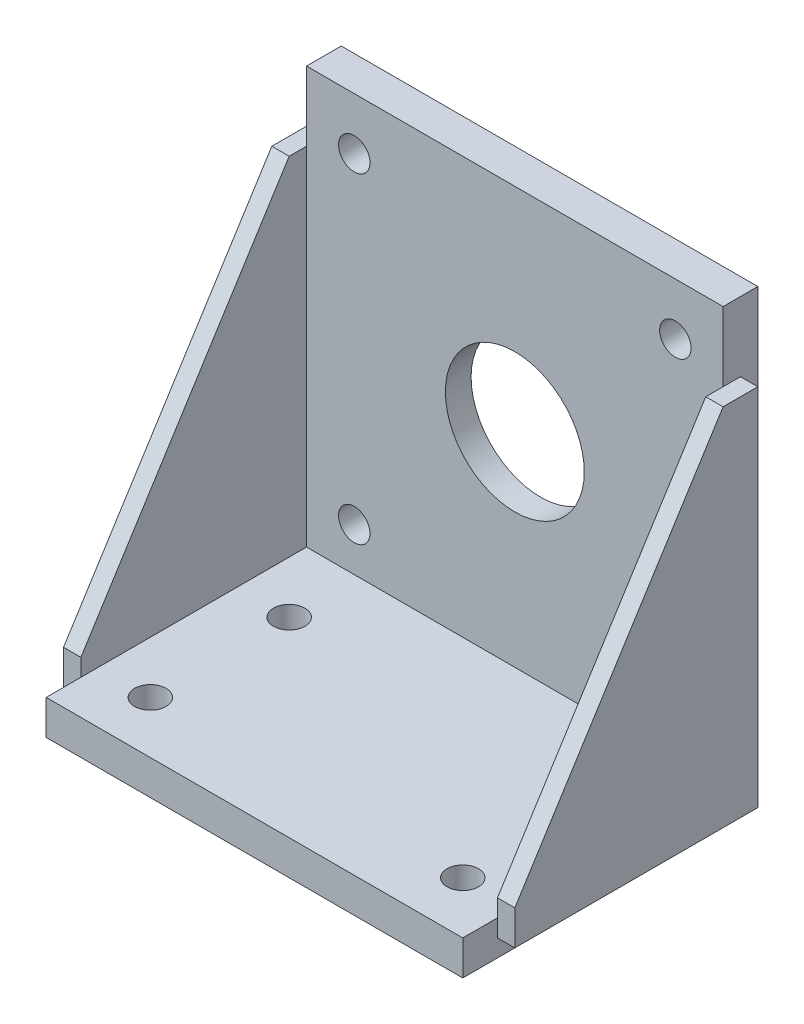
from build123d import *

# Parameters (mm, degrees)
SKETCH1_W                 = 152.4
SKETCH1_H                 = 152.4
BASE_EXTRUDE_DEPTH        = 12.7
SKETCH2_W                 = 101.6
SKETCH2_H                 = 12.7
BOSS_EXTRUDE1_DEPTH       = 152.4
BOSS_EXTRUDE2_DEPTH       = 6.35
SKETCH5_R                 = 63.5635
PILOT_BORE_DEPTH          = 3.302
SKETCH6_R                 = 25.4
CUT_EXTRUDE3_DEPTH        = 160.339822581
SKETCH_PATTERN1_OUTLINE_R = 5.75437
SKETCH_PATTERN1_DEPTH     = 12.7
LPATTERN1_COUNT           = 2
LPATTERN1_PITCH           = 114.3
LPATTERN1_COUNT_DIR2      = 2
LPATTERN1_PITCH_DIR2      = 50.8


# Read off the part's stored shape, not the designer's step: Sketch-Pattern1
with BuildPart() as part:
    # Sketch1 → Base-Extrude (new body)
    with BuildSketch(Plane.XY):
        with Locations((0, 1.5875)):
            Rectangle(SKETCH1_W, SKETCH1_H)
    extrude(amount=BASE_EXTRUDE_DEPTH)

    # Sketch2 → Boss-Extrude1 (add)
    with BuildSketch(Plane(origin=(76.2, 0, 0), x_dir=(0, 0, -1), z_dir=(1, 0, 0))):
        with Locations((-57.15, -80.9625)):
            Rectangle(SKETCH2_W, SKETCH2_H)
    extrude(amount=-BOSS_EXTRUDE1_DEPTH)

    # Sketch3 → Boss-Extrude2 (add)
    with BuildSketch(Plane(origin=(76.2, 0, 0), x_dir=(0, 0, -1), z_dir=(1, 0, 0))):
        Polygon((-6.35, -80.9625), (-6.35, 52.3875), (-19.05, 52.3875), (-95.25, -68.2625), (-95.25, -80.9625), align=None)
    boss_extrude2 = extrude(amount=BOSS_EXTRUDE2_DEPTH)

    # Mirror1: Boss-Extrude2 across plane
    add(boss_extrude2.mirror(Plane(origin=(0, 0, 0), x_dir=(0, 0, 1), z_dir=(1, 0, 0))))

    # Sketch5 → pilot bore (cut)
    with BuildSketch(Plane(origin=(0, 0, 0), x_dir=(-1, 0, 0), z_dir=(0, 0, -1))):
        Circle(SKETCH5_R)
    extrude(amount=-PILOT_BORE_DEPTH, mode=Mode.SUBTRACT)

    # Sketch6 → Cut-Extrude3 (cut, through all)
    with BuildSketch(Plane(origin=(0, 0, 3.302), x_dir=(-1, 0, 0), z_dir=(0, 0, -1))):
        Circle(SKETCH6_R)
    extrude(amount=-CUT_EXTRUDE3_DEPTH, mode=Mode.SUBTRACT)

    # Sketch7 → 1/2-20 Tapped Hole1 (revolve, cut)
    with BuildSketch(Plane(origin=(-58.7375, -58.7375, 12.7), x_dir=(0, -1, 0), z_dir=(1, 0, 0))):
        Polygon((0, 0), (0, 35.20757432), (5.75437, 31.75), (5.75437, 0), align=None)
    revolve(axis=Axis((-58.7375, -58.7375, 19.05), (0, 0, -1)), mode=Mode.SUBTRACT)

    # Sketch-Pattern1 outline → Sketch-Pattern1 (cut)
    with BuildSketch(Plane.XY):
        with Locations((-58.7375, 58.7375)):
            Circle(SKETCH_PATTERN1_OUTLINE_R)
        with Locations((58.7375, 58.7375)):
            Circle(SKETCH_PATTERN1_OUTLINE_R)
        with Locations((58.7375, -58.7375)):
            Circle(SKETCH_PATTERN1_OUTLINE_R)
    extrude(amount=SKETCH_PATTERN1_DEPTH, mode=Mode.SUBTRACT)

    # Sketch9 → 1/2-20 Tapped Hole2 (revolve, cut)
    with BuildSketch(Plane(origin=(-57.15, -74.6125, 88.9), x_dir=(0, 0, 1), z_dir=(1, 0, 0))):
        Polygon((0, 0), (0, 35.20757432), (5.75437, 31.75), (5.75437, 0), align=None)
    f_1_2_20_tapped_hole2 = revolve(axis=Axis((-57.15, -68.2625, 88.9), (0, -1, 0)), mode=Mode.SUBTRACT)

    # LPattern1: 1_2-20 Tapped Hole2 2 × 2
    with Locations(*[(i * LPATTERN1_PITCH, 0, -j * LPATTERN1_PITCH_DIR2) for i in range(LPATTERN1_COUNT) for j in range(LPATTERN1_COUNT_DIR2) if (i, j) != (0, 0)]):
        add(f_1_2_20_tapped_hole2, mode=Mode.SUBTRACT)


solid = part.part
